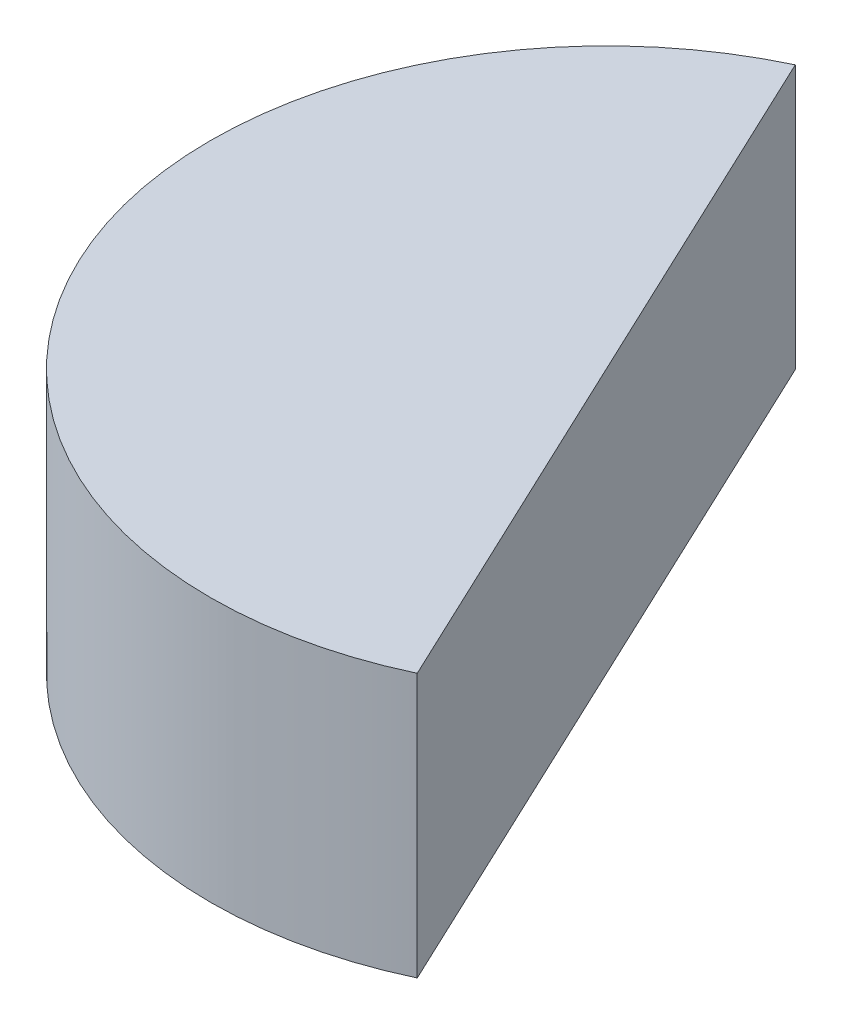
from build123d import *

# Parameters (mm, degrees)
BOSS_EXTRUDE1_DEPTH = 25.4


with BuildPart() as part:
    # Sketch1 → Boss-Extrude1 (new body)
    with BuildSketch(Plane(origin=(0, 0, 0), x_dir=(1, 0, 0), z_dir=(0, 1, 0))):
        with BuildLine():
            Line((16.262082665, -34.455110904), (-16.262082665, 34.455110904))
            ThreePointArc((-16.262082665, 34.455110904), (-34.455110904, -16.262082665), (16.262082665, -34.455110904))
        make_face()
    extrude(amount=BOSS_EXTRUDE1_DEPTH)


solid = part.part
